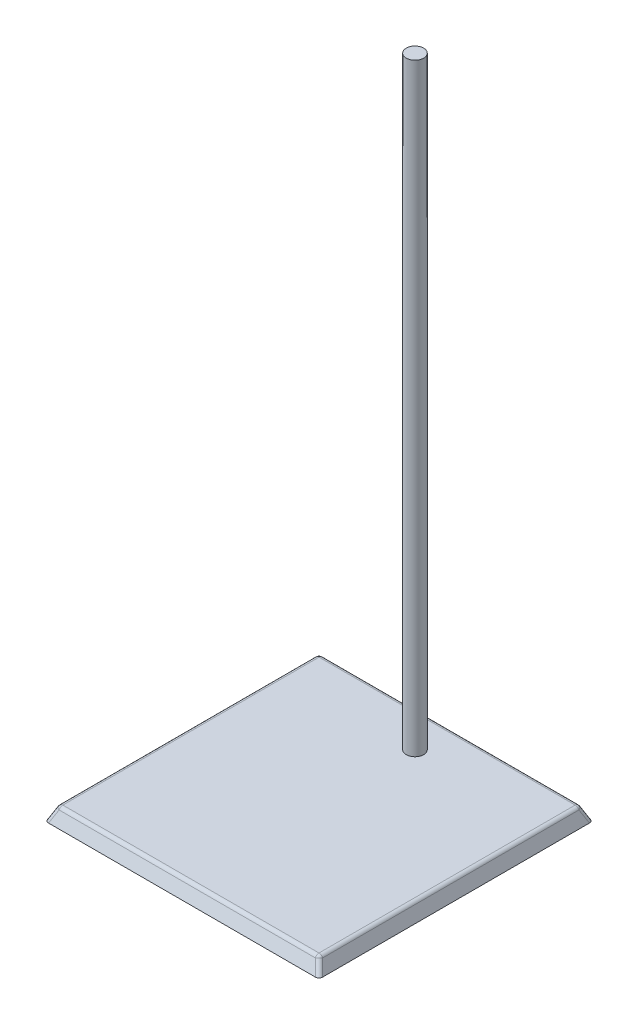
from build123d import *
from OCP.BRepFilletAPI import BRepFilletAPI_MakeChamfer

# Parameters (mm, degrees)
SKETCH1_R           = 6.35
BOSS_EXTRUDE1_DEPTH = 450
SKETCH2_W           = 200
SKETCH2_H           = 200
BOSS_EXTRUDE2_DEPTH = 10
CHAMFER1_SIZE       = 10
CHAMFER1_SIZE_2     = 4.663076582
FILLET1_R           = 3


# Some blends are built 0.0001 mm under size
with BuildPart() as part:
    # Sketch1 → Boss-Extrude1 (new body)
    with BuildSketch(Plane(origin=(0, 0, 0), x_dir=(1, 0, 0), z_dir=(0, 1, 0))):
        with Locations(Location((0, 0, 0), (0, 0, 270))):
            Circle(SKETCH1_R)
    extrude(amount=BOSS_EXTRUDE1_DEPTH)

    # Sketch2 → Boss-Extrude2 (add)
    with BuildSketch(Plane(origin=(0, 0, 0), x_dir=(1, 0, 0), z_dir=(0, 1, 0))):
        with Locations((0, -70)):
            Rectangle(SKETCH2_W, SKETCH2_H)
    extrude(amount=BOSS_EXTRUDE2_DEPTH)

    # Chamfer1
    chamfer1_edges_1 = [part.edges().sort_by_distance(p)[0] for p in [
        (-100, 10, 70),
    ]]
    chamfer1_side_1 = [part.faces().sort_by_distance(p)[0] for p in [
        (-100, 9.906738468, 70),
    ]]
    chamfer1_edges_2 = [part.edges().sort_by_distance(p)[0] for p in [
        (0, 10, -30),
    ]]
    chamfer1_side_2 = [part.faces().sort_by_distance(p)[0] for p in [
        (0, 9.906738468, -30),
    ]]
    chamfer1_edges_3 = [part.edges().sort_by_distance(p)[0] for p in [
        (100, 10, 70),
    ]]
    chamfer1_side_3 = [part.faces().sort_by_distance(p)[0] for p in [
        (100, 9.906738468, 70),
    ]]
    chamfer1_edges_4 = [part.edges().sort_by_distance(p)[0] for p in [
        (0, 10, 170),
    ]]
    chamfer1_side_4 = [part.faces().sort_by_distance(p)[0] for p in [
        (0, 9.906738468, 170),
    ]]
    chamfer1 = BRepFilletAPI_MakeChamfer(part.part.solid().wrapped)
    for e in chamfer1_edges_1:
        chamfer1.Add(CHAMFER1_SIZE - 0.0001, CHAMFER1_SIZE_2 - 0.0001, e.wrapped, chamfer1_side_1[0].wrapped)
    for e in chamfer1_edges_2:
        chamfer1.Add(CHAMFER1_SIZE - 0.0001, CHAMFER1_SIZE_2 - 0.0001, e.wrapped, chamfer1_side_2[0].wrapped)
    for e in chamfer1_edges_3:
        chamfer1.Add(CHAMFER1_SIZE - 0.0001, CHAMFER1_SIZE_2 - 0.0001, e.wrapped, chamfer1_side_3[0].wrapped)
    for e in chamfer1_edges_4:
        chamfer1.Add(CHAMFER1_SIZE - 0.0001, CHAMFER1_SIZE_2 - 0.0001, e.wrapped, chamfer1_side_4[0].wrapped)
    add(Compound.cast(chamfer1.Shape()), mode=Mode.REPLACE)  # a hair under: the kernel refuses the full size

    # Fillet1
    # the kernel refuses this fillet: 3 mm, written as the material it takes off along each edge
    with BuildSketch(Plane(origin=(93.425803391, 7, 163.425803391), x_dir=(0.8181037420217215, -0.5211920852493197, 0.24303307915492178), z_dir=(0.40339585418655427, 0.8213060146195212, 0.4033958541865531))) as fillet1_piece_1_section:
        Polygon((-4.845611884, -4.845611884), (4.845611884, -4.845611884), (4.845611884, 4.845611884), (-4.845611884, 4.845611884), align=None)
    fillet1_piece_1 = extrude(amount=4.845611884, mode=Mode.PRIVATE)
    fillet1_piece_1 = split(fillet1_piece_1, bisect_by=Plane(origin=(93.425803391, 7, 163.425803391), z_dir=(-0.3892785155895378, 0.834820025275396, -0.3892785155895367)), keep=Keep.TOP, mode=Mode.PRIVATE)
    fillet1_piece_1 = split(fillet1_piece_1, bisect_by=Plane(origin=(93.425803391, 7, 163.425803391), z_dir=(0, 0, 1)), keep=Keep.TOP, mode=Mode.PRIVATE)
    fillet1_piece_1 = split(fillet1_piece_1, bisect_by=Plane(origin=(93.425803391, 7, 163.425803391), z_dir=(1, 0, 0)), keep=Keep.TOP, mode=Mode.PRIVATE)
    fillet1_piece_1 = split(fillet1_piece_1, bisect_by=Plane(origin=(93.425803391, 8.267842866, 166.14473231), z_dir=(-2.562508249607615e-15, -0.42261428872649237, -0.9063096396729988)), keep=Keep.TOP, mode=Mode.PRIVATE)
    fillet1_piece_1 = split(fillet1_piece_1, bisect_by=Plane(origin=(96.14473231, 8.267842866, 163.425803391), z_dir=(-0.9063096396729988, -0.4226142887264923, 0)), keep=Keep.TOP, mode=Mode.PRIVATE)
    fillet1_piece_1 = split(fillet1_piece_1, bisect_by=Plane(origin=(93.425803391, 10, 163.425803391), z_dir=(0, -1, 0)), keep=Keep.TOP, mode=Mode.PRIVATE)
    fillet1_piece_1 = fillet1_piece_1 - Plane(origin=(93.425803391, 7, 163.425803391), x_dir=(-0.40339585418655427, -0.8213060146195212, -0.4033958541865531), z_dir=(0.8181037420217215, -0.5211920852493197, 0.24303307915492178)) * Sphere(FILLET1_R, mode=Mode.PRIVATE)
    add(fillet1_piece_1, mode=Mode.SUBTRACT)
    with BuildSketch(Plane(origin=(-93.425803391, 7, 163.425803391), x_dir=(-0.24303307915492378, -0.5211920852493191, 0.8181037420217212), z_dir=(-0.4033958541865524, 0.821306014619522, 0.4033958541865535))) as fillet1_piece_2_section:
        Polygon((-4.845611884, -4.845611884), (4.845611884, -4.845611884), (4.845611884, 4.845611884), (-4.845611884, 4.845611884), align=None)
    fillet1_piece_2 = extrude(amount=4.845611884, mode=Mode.PRIVATE)
    fillet1_piece_2 = split(fillet1_piece_2, bisect_by=Plane(origin=(-93.425803391, 7, 163.425803391), z_dir=(0.3892785155895374, 0.8348200252753952, -0.38927851558953863)), keep=Keep.TOP, mode=Mode.PRIVATE)
    fillet1_piece_2 = split(fillet1_piece_2, bisect_by=Plane(origin=(-93.425803391, 7, 163.425803391), z_dir=(-1, 0, 0)), keep=Keep.TOP, mode=Mode.PRIVATE)
    fillet1_piece_2 = split(fillet1_piece_2, bisect_by=Plane(origin=(-93.425803391, 7, 163.425803391), z_dir=(0, 0, 1)), keep=Keep.TOP, mode=Mode.PRIVATE)
    fillet1_piece_2 = split(fillet1_piece_2, bisect_by=Plane(origin=(-96.14473231, 8.267842866, 163.425803391), z_dir=(0.9063096396729988, -0.4226142887264923, 0)), keep=Keep.TOP, mode=Mode.PRIVATE)
    fillet1_piece_2 = split(fillet1_piece_2, bisect_by=Plane(origin=(-93.425803391, 8.267842866, 166.14473231), z_dir=(-2.562508249607615e-15, -0.42261428872649237, -0.9063096396729988)), keep=Keep.TOP, mode=Mode.PRIVATE)
    fillet1_piece_2 = split(fillet1_piece_2, bisect_by=Plane(origin=(-93.425803391, 10, 163.425803391), z_dir=(0, -1, 0)), keep=Keep.TOP, mode=Mode.PRIVATE)
    fillet1_piece_2 = fillet1_piece_2 - Plane(origin=(-93.425803391, 7, 163.425803391), x_dir=(0.4033958541865524, -0.821306014619522, -0.4033958541865535), z_dir=(-0.24303307915492378, -0.5211920852493191, 0.8181037420217212)) * Sphere(FILLET1_R, mode=Mode.PRIVATE)
    add(fillet1_piece_2, mode=Mode.SUBTRACT)
    with BuildSketch(Plane(origin=(93.425803391, 7, -23.425803391), x_dir=(-0.8181037420217211, 0.5211920852493194, 0.2430330791549239), z_dir=(0.4033958541865533, 0.8213060146195218, -0.4033958541865533))) as fillet1_piece_3_section:
        Polygon((-4.845611884, -4.845611884), (4.845611884, -4.845611884), (4.845611884, 4.845611884), (-4.845611884, 4.845611884), align=None)
    fillet1_piece_3 = extrude(amount=4.845611884, mode=Mode.PRIVATE)
    fillet1_piece_3 = split(fillet1_piece_3, bisect_by=Plane(origin=(93.425803391, 7, -23.425803391), z_dir=(-0.3892785155895376, 0.8348200252753957, 0.3892785155895376)), keep=Keep.TOP, mode=Mode.PRIVATE)
    fillet1_piece_3 = split(fillet1_piece_3, bisect_by=Plane(origin=(93.425803391, 7, -23.425803391), z_dir=(0, 0, -1)), keep=Keep.TOP, mode=Mode.PRIVATE)
    fillet1_piece_3 = split(fillet1_piece_3, bisect_by=Plane(origin=(93.425803391, 7, -23.425803391), z_dir=(1, 0, 0)), keep=Keep.TOP, mode=Mode.PRIVATE)
    fillet1_piece_3 = split(fillet1_piece_3, bisect_by=Plane(origin=(93.425803391, 8.267842866, -26.14473231), z_dir=(0, -0.4226142887264923, 0.9063096396729988)), keep=Keep.TOP, mode=Mode.PRIVATE)
    fillet1_piece_3 = split(fillet1_piece_3, bisect_by=Plane(origin=(96.14473231, 8.267842866, -23.425803391), z_dir=(-0.9063096396729988, -0.4226142887264923, 0)), keep=Keep.TOP, mode=Mode.PRIVATE)
    fillet1_piece_3 = split(fillet1_piece_3, bisect_by=Plane(origin=(93.425803391, 10, -23.425803391), z_dir=(0, -1, 0)), keep=Keep.TOP, mode=Mode.PRIVATE)
    fillet1_piece_3 = fillet1_piece_3 - Plane(origin=(93.425803391, 7, -23.425803391), x_dir=(-0.4033958541865533, -0.8213060146195218, 0.4033958541865533), z_dir=(-0.8181037420217211, 0.5211920852493194, 0.2430330791549239)) * Sphere(FILLET1_R, mode=Mode.PRIVATE)
    add(fillet1_piece_3, mode=Mode.SUBTRACT)
    with BuildSketch(Plane(origin=(-93.425803391, 7, -23.425803391), x_dir=(0.2430330791549239, 0.5211920852493194, 0.8181037420217211), z_dir=(-0.4033958541865533, 0.8213060146195218, -0.4033958541865533))) as fillet1_piece_4_section:
        Polygon((-4.845611884, -4.845611884), (4.845611884, -4.845611884), (4.845611884, 4.845611884), (-4.845611884, 4.845611884), align=None)
    fillet1_piece_4 = extrude(amount=4.845611884, mode=Mode.PRIVATE)
    fillet1_piece_4 = split(fillet1_piece_4, bisect_by=Plane(origin=(-93.425803391, 7, -23.425803391), z_dir=(0.3892785155895376, 0.8348200252753957, 0.3892785155895376)), keep=Keep.TOP, mode=Mode.PRIVATE)
    fillet1_piece_4 = split(fillet1_piece_4, bisect_by=Plane(origin=(-93.425803391, 7, -23.425803391), z_dir=(-1, 0, 0)), keep=Keep.TOP, mode=Mode.PRIVATE)
    fillet1_piece_4 = split(fillet1_piece_4, bisect_by=Plane(origin=(-93.425803391, 7, -23.425803391), z_dir=(0, 0, -1)), keep=Keep.TOP, mode=Mode.PRIVATE)
    fillet1_piece_4 = split(fillet1_piece_4, bisect_by=Plane(origin=(-96.14473231, 8.267842866, -23.425803391), z_dir=(0.9063096396729988, -0.4226142887264923, 0)), keep=Keep.TOP, mode=Mode.PRIVATE)
    fillet1_piece_4 = split(fillet1_piece_4, bisect_by=Plane(origin=(-93.425803391, 8.267842866, -26.14473231), z_dir=(0, -0.4226142887264923, 0.9063096396729988)), keep=Keep.TOP, mode=Mode.PRIVATE)
    fillet1_piece_4 = split(fillet1_piece_4, bisect_by=Plane(origin=(-93.425803391, 10, -23.425803391), z_dir=(0, -1, 0)), keep=Keep.TOP, mode=Mode.PRIVATE)
    fillet1_piece_4 = fillet1_piece_4 - Plane(origin=(-93.425803391, 7, -23.425803391), x_dir=(0.4033958541865533, -0.8213060146195218, 0.4033958541865533), z_dir=(0.2430330791549239, 0.5211920852493194, 0.8181037420217211)) * Sphere(FILLET1_R, mode=Mode.PRIVATE)
    add(fillet1_piece_4, mode=Mode.SUBTRACT)
    with BuildSketch(Plane(origin=(93.425803391, 10, 165.337023418), x_dir=(0, -0.9063096396729513, 0.4226142887265943), z_dir=(-1, 0, 0)), Plane(origin=(95.337023418, 10, -23.425803391), x_dir=(0.4226142887264939, -0.9063096396729982, 0), z_dir=(0, 0, 1))) as fillet1_piece_5:
        with BuildLine():
            CenterArc((FILLET1_R * 0.637073342265, -FILLET1_R), FILLET1_R, 90, 65.000251169)
            Line((-FILLET1_R * 0.269236297408, -FILLET1_R * 0.577385711273), (0, 0))
            Line((0, 0), (FILLET1_R * 0.637073342265, 0))
        make_face()
    extrude(amount=186.851606782, mode=Mode.SUBTRACT)
    with BuildSketch(Plane(origin=(-93.425803391, 10, -25.337023418), x_dir=(0, 0, 1), z_dir=(1, 0, 0)), Plane(origin=(-95.337023418, 10, 163.425803391), x_dir=(1, 0, 0), z_dir=(0, 0, -1))) as fillet1_piece_6:
        with BuildLine():
            CenterArc((FILLET1_R * 0.637073342265, FILLET1_R), FILLET1_R, 204.999748831, 65.000251169)
            Line((-FILLET1_R * 0.269236297408, FILLET1_R * 0.577385711274), (0, 0))
            Line((0, 0), (FILLET1_R * 0.637073342265, 0))
        make_face()
    extrude(amount=186.851606782, mode=Mode.SUBTRACT)
    with BuildSketch(Plane(origin=(102.437331252, -5.22683356, -32.437331252), x_dir=(0.16451466298238407, -0.3528068711963904, 0.9211200992815249), z_dir=(-0.3892785155895376, 0.8348200252753957, 0.3892785155895376)), Plane(origin=(102.437331252, -5.22683356, 172.437331252), x_dir=(-0.9211200992815247, -0.3528068711963899, 0.16451466298238568), z_dir=(-0.38927851558953774, 0.834820025275396, -0.3892785155895367))) as fillet1_piece_7:
        with BuildLine():
            CenterArc((FILLET1_R * 0.834820025275, -FILLET1_R), FILLET1_R, 90, 79.711610414)
            Line((-FILLET1_R * 0.149101224928, -FILLET1_R * 0.821397162964), (0, 0))
            Line((0, 0), (FILLET1_R * 0.834820025275, 0))
        make_face()
    extrude(amount=17.223193879, mode=Mode.SUBTRACT)
    with BuildSketch(Plane(origin=(-102.437331252, -5.22683356, -32.437331252), x_dir=(-0.16451466298237352, -0.35280687119639537, 0.9211200992815248), z_dir=(0.3892785155895376, 0.8348200252753957, 0.3892785155895376)), Plane(origin=(-102.437331252, -5.22683356, 172.437331252), x_dir=(0.9211200992815248, -0.35280687119640064, 0.16451466298236184), z_dir=(0.38927851558953747, 0.8348200252753953, -0.38927851558953863))) as fillet1_piece_8:
        with BuildLine():
            CenterArc((FILLET1_R * 0.834820025275, FILLET1_R), FILLET1_R, 190.288389586, 79.711610414)
            Line((-FILLET1_R * 0.149101224928, FILLET1_R * 0.821397162964), (0, 0))
            Line((0, 0), (FILLET1_R * 0.834820025275, 0))
        make_face()
    extrude(amount=17.223193879, mode=Mode.SUBTRACT)


solid = part.part
